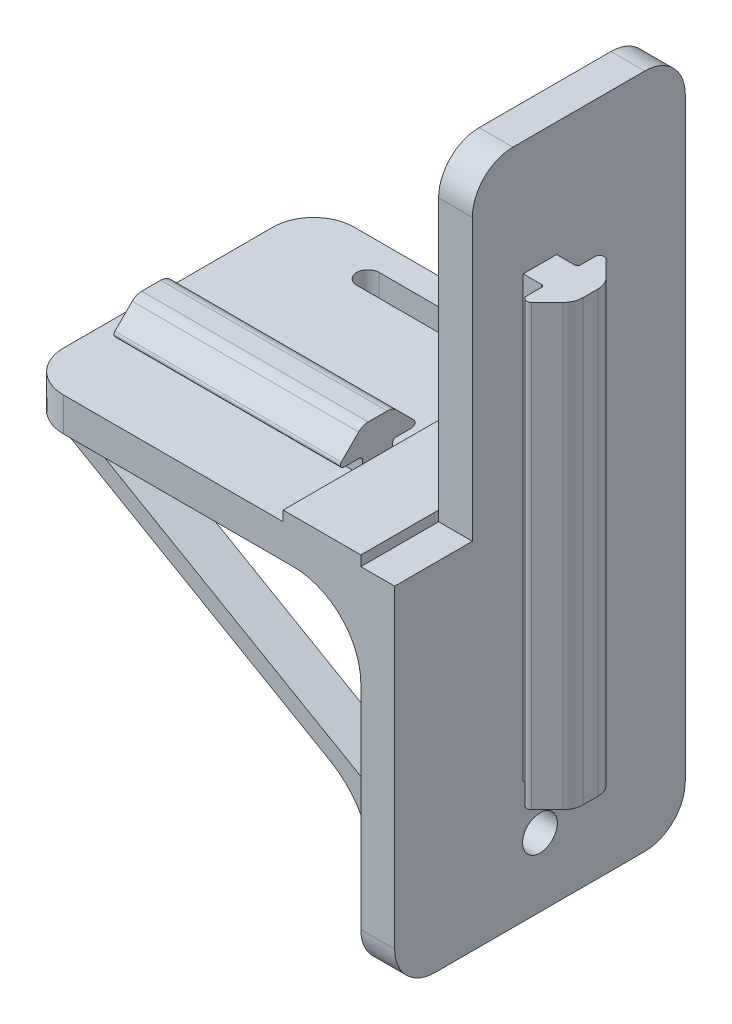
from build123d import *

# Parameters (mm, degrees)
BOSS_EXTRUDE5_DEPTH  = 50
SKETCH11_W           = 43
SKETCH11_H           = 100
BOSS_EXTRUDE6_DEPTH  = 5
BOSS_EXTRUDE8_DEPTH  = 55
SKETCH13_W           = 11.5
SKETCH13_H           = 47.5
CUT_EXTRUDE1_DEPTH   = 55
BOSS_EXTRUDE9_DEPTH  = 6
FILLET7_R            = 12
FILLET7_OF_MIRROR1_R = 12
FILLET8_R            = 6
BOSS_EXTRUDE10_START = 8
BOSS_EXTRUDE10_DEPTH = 8
FILLET12_R           = 10
BOSS_EXTRUDE11_DEPTH = 57
SKETCH16_R           = 2.575
CUT_EXTRUDE2_DEPTH   = 10
SKETCH17_W           = 27.480150942
SKETCH17_H           = 1.5
BOSS_EXTRUDE12_DEPTH = 11.5
BOSS_EXTRUDE15_START = -5
BOSS_EXTRUDE15_DEPTH = 33.5
CUT_EXTRUDE3_DEPTH   = 6


with BuildPart() as part:
    # Sketch9 → Boss-Extrude5 (new body)
    with BuildSketch(Plane(origin=(0, 245, 0), x_dir=(1, 0, 0), z_dir=(0, 1, 0))):
        with BuildLine():
            Line((389.629800237, -111.599739584), (387.629800237, -111.599739584))
            Line((387.629800237, -111.599739584), (387.629800237, -106.649739584))
            Line((387.629800237, -106.649739584), (389.629800237, -106.649739584))
            Line((389.629800237, -106.649739584), (390.329799474, -106.649739584))
            ThreePointArc((390.329799474, -106.649739584), (390.605571069, -106.535511279), (390.719799474, -106.259739725))
            Line((390.719799474, -106.259739725), (390.719800256, -104.090618139))
            ThreePointArc((390.719800256, -104.090618139), (391.145748802, -103.453141463), (391.897703935, -103.602714709))
            Line((391.897703935, -103.602714709), (394.237480965, -105.942491739))
            ThreePointArc((394.237480965, -105.942491739), (394.868289671, -106.886563682), (395.089800232, -108.000172467))
            Line((395.089800232, -108.000172467), (395.089800237, -110.249306685))
            ThreePointArc((395.089800237, -110.249306685), (394.868289678, -111.362915477), (394.23748097, -112.306987424))
            Line((394.23748097, -112.306987424), (391.897703941, -114.646764454))
            ThreePointArc((391.897703941, -114.646764454), (391.145748809, -114.7963377), (390.719800262, -114.158861025))
            Line((390.719800262, -114.158861025), (390.719799474, -111.989739443))
            ThreePointArc((390.719799474, -111.989739443), (390.605571069, -111.71396789), (390.329799474, -111.599739584))
            Line((390.329799474, -111.599739584), (389.629800237, -111.599739584))
        make_face()
    extrude(amount=-BOSS_EXTRUDE5_DEPTH)

    # Sketch11 → Boss-Extrude6 (add)
    with BuildSketch(Plane.ZY.offset(-387.629800242)):
        with Locations((109.124739584, 220)):
            Rectangle(SKETCH11_W, SKETCH11_H)
    extrude(amount=BOSS_EXTRUDE6_DEPTH)

    # Sketch12 → Boss-Extrude8 (add)
    with BuildSketch(Plane.ZY.offset(-387.629800242)):
        Polygon((130.624739584, 222.5), (89.124739584, 222.5), (87.624739584, 222.5), (87.624739584, 217.5), (89.124739584, 217.5), (130.624739584, 217.5), align=None)
    extrude(amount=BOSS_EXTRUDE8_DEPTH)

    # Sketch13 → Cut-Extrude1 (cut)
    with BuildSketch(Plane.ZY.offset(-387.629800242)):
        with Locations((124.874739584, 246.25)):
            Rectangle(SKETCH13_W, SKETCH13_H)
    extrude(amount=CUT_EXTRUDE1_DEPTH, mode=Mode.SUBTRACT)

    # Sketch15 → Boss-Extrude9 (add)
    with BuildSketch(Plane.XY.offset(129.124739584)):
        Polygon((335.629800242, 217.5), (382.629800242, 190.364537348), (382.629800242, 193.251288694), (340.629800242, 217.5), align=None)
    boss_extrude9 = extrude(amount=-BOSS_EXTRUDE9_DEPTH)

    # Fillet7
    # the kernel refuses this fillet: 12 mm, written as the material it adds along each edge
    with BuildSketch(Plane(origin=(335.629800242, 217.5, 129.124739584), x_dir=(-1, 0, 0), z_dir=(0, 0, -1))) as fillet7_piece_1:
        with BuildLine():
            CenterArc((3.218847051, -11.998004249), FILLET7_R, 91.044975628, 28.955024372)
            Line((-2.781152949, -1.605699404), (-2.901152949, -1.397853307))
            Line((-2.901152949, -1.397853307), (-0.12, 0.207846097))
            Line((-0.12, 0.207846097), (0, 0.24))
            ThreePointArc((0, 0.24), (1.5, 0.24), (2.995623059, 0.239960085))
            Line((2.995623059, 0.239960085), (3, 0))
        make_face()
    extrude(amount=6)
    with BuildSketch(Plane(origin=(382.629800242, 190.364537348, 129.124739584), x_dir=(0, -1, 0), z_dir=(0, 0, -1))) as fillet7_piece_2:
        with BuildLine():
            CenterArc((FILLET7_R * 0.57735026919, FILLET7_R), FILLET7_R, 210, 60)
            Line((-FILLET7_R * 0.288675134595, FILLET7_R * 0.5), (-FILLET7_R * 0.305995642671, FILLET7_R * 0.49))
            Line((-FILLET7_R * 0.305995642671, FILLET7_R * 0.49), (-FILLET7_R * 0.0115470053838, -FILLET7_R * 0.02))
            Line((-FILLET7_R * 0.0115470053838, -FILLET7_R * 0.02), (FILLET7_R * 0.57735026919, -FILLET7_R * 0.02))
            Line((FILLET7_R * 0.57735026919, -FILLET7_R * 0.02), (FILLET7_R * 0.57735026919, 0))
        make_face()
    extrude(amount=6)

    # Mirror1: Boss-Extrude9 across plane
    add(boss_extrude9.mirror(Plane.XY.offset(110.624739584)))

    # Fillet7 of Mirror1
    # the kernel refuses this fillet: 12 mm, written as the material it adds along each edge
    with BuildSketch(Plane(origin=(335.629800242, 217.5, 92.124739584), x_dir=(-1, 0, 0), z_dir=(0, 0, 1))) as fillet7_of_mirror1_piece_1:
        with BuildLine():
            CenterArc((3.218847051, 11.998004249), FILLET7_OF_MIRROR1_R, 240, 28.955024372)
            Line((-2.781152949, 1.605699404), (-2.901152949, 1.397853307))
            Line((-2.901152949, 1.397853307), (-0.12, -0.207846097))
            Line((-0.12, -0.207846097), (0, -0.24))
            ThreePointArc((0, -0.24), (1.5, -0.24), (2.995623059, -0.239960085))
            Line((2.995623059, -0.239960085), (3, 0))
        make_face()
    extrude(amount=6)
    with BuildSketch(Plane(origin=(382.629800242, 190.364537348, 92.124739584), x_dir=(0, -1, 0), z_dir=(0, 0, 1))) as fillet7_of_mirror1_piece_2:
        with BuildLine():
            CenterArc((FILLET7_OF_MIRROR1_R * 0.57735026919, -FILLET7_OF_MIRROR1_R), FILLET7_OF_MIRROR1_R, 90, 60)
            Line((-FILLET7_OF_MIRROR1_R * 0.288675134595, -FILLET7_OF_MIRROR1_R * 0.5), (-FILLET7_OF_MIRROR1_R * 0.305995642671, -FILLET7_OF_MIRROR1_R * 0.49))
            Line((-FILLET7_OF_MIRROR1_R * 0.305995642671, -FILLET7_OF_MIRROR1_R * 0.49), (-FILLET7_OF_MIRROR1_R * 0.0115470053838, FILLET7_OF_MIRROR1_R * 0.02))
            Line((-FILLET7_OF_MIRROR1_R * 0.0115470053838, FILLET7_OF_MIRROR1_R * 0.02), (FILLET7_OF_MIRROR1_R * 0.57735026919, FILLET7_OF_MIRROR1_R * 0.02))
            Line((FILLET7_OF_MIRROR1_R * 0.57735026919, FILLET7_OF_MIRROR1_R * 0.02), (FILLET7_OF_MIRROR1_R * 0.57735026919, 0))
        make_face()
    extrude(amount=6)

    # Fillet8
    # the kernel refuses this fillet: 6 mm, written as the material it takes off along each edge
    with BuildSketch(Plane(origin=(402.629800242, 270, 87.624739584), x_dir=(0, 0, 1), z_dir=(-1, 0, 0)), Plane(origin=(332.629800242, 237.5, 87.624739584), x_dir=(0, 0, 1), z_dir=(0, -1, 0)), Plane(origin=(402.629800242, 270, 119.124739584), x_dir=(0, -1, 0), z_dir=(-1, 0, 0))) as fillet8_piece_1:
        with BuildLine():
            CenterArc((FILLET8_R, -FILLET8_R), FILLET8_R, 90, 90)
            Line((0, -FILLET8_R), (0, 0))
            Line((0, 0), (FILLET8_R, 0))
        make_face()
    extrude(amount=35, mode=Mode.SUBTRACT)
    with BuildSketch(Plane(origin=(402.629800242, 170, 87.624739584), x_dir=(0, 0, 1), z_dir=(-1, 0, 0)), Plane(origin=(402.629800242, 170, 130.624739584), x_dir=(0, 1, 0), z_dir=(-1, 0, 0)), Plane(origin=(332.629800242, 202.5, 130.624739584), x_dir=(1, 0, 0), z_dir=(0, 1, 0))) as fillet8_piece_2:
        with BuildLine():
            CenterArc((FILLET8_R, FILLET8_R), FILLET8_R, 180, 90)
            Line((0, FILLET8_R), (0, 0))
            Line((0, 0), (FILLET8_R, 0))
        make_face()
    extrude(amount=35, mode=Mode.SUBTRACT)

    # Sketch9<2> → Boss-Extrude10 (add)
    with BuildSketch(Plane(origin=(0, 245, 0), x_dir=(1, 0, 0), z_dir=(0, 1, 0)).offset(BOSS_EXTRUDE10_START)):
        with BuildLine():
            Line((389.629800237, -111.599739584), (387.629800237, -111.599739584))
            Line((387.629800237, -111.599739584), (387.629800237, -106.649739584))
            Line((387.629800237, -106.649739584), (389.629800237, -106.649739584))
            Line((389.629800237, -106.649739584), (390.329799474, -106.649739584))
            ThreePointArc((390.329799474, -106.649739584), (390.605571069, -106.535511279), (390.719799474, -106.259739725))
            Line((390.719799474, -106.259739725), (390.719800256, -104.090618139))
            ThreePointArc((390.719800256, -104.090618139), (391.145748802, -103.453141463), (391.897703935, -103.602714709))
            Line((391.897703935, -103.602714709), (394.237480965, -105.942491739))
            ThreePointArc((394.237480965, -105.942491739), (394.868289671, -106.886563682), (395.089800232, -108.000172467))
            Line((395.089800232, -108.000172467), (395.089800237, -110.249306685))
            ThreePointArc((395.089800237, -110.249306685), (394.868289678, -111.362915477), (394.23748097, -112.306987424))
            Line((394.23748097, -112.306987424), (391.897703941, -114.646764454))
            ThreePointArc((391.897703941, -114.646764454), (391.145748809, -114.7963377), (390.719800262, -114.158861025))
            Line((390.719800262, -114.158861025), (390.719799474, -111.989739443))
            ThreePointArc((390.719799474, -111.989739443), (390.605571069, -111.71396789), (390.329799474, -111.599739584))
            Line((390.329799474, -111.599739584), (389.629800237, -111.599739584))
        make_face()
    extrude(amount=-BOSS_EXTRUDE10_DEPTH)

    # Fillet12
    fillet12_edges = [part.edges().sort_by_distance(p)[0] for p in [
        (382.629800242, 217.5, 109.124739584),
    ]]
    fillet(fillet12_edges, radius=FILLET12_R)

    # Sketch9<3> → Boss-Extrude11 (add)
    with BuildSketch(Plane(origin=(0, 245, 0), x_dir=(1, 0, 0), z_dir=(0, 1, 0))):
        with BuildLine():
            Line((389.629800237, -111.599739584), (387.629800237, -111.599739584))
            Line((387.629800237, -111.599739584), (387.629800237, -106.649739584))
            Line((387.629800237, -106.649739584), (389.629800237, -106.649739584))
            Line((389.629800237, -106.649739584), (390.329799474, -106.649739584))
            ThreePointArc((390.329799474, -106.649739584), (390.605571069, -106.535511279), (390.719799474, -106.259739725))
            Line((390.719799474, -106.259739725), (390.719800256, -104.090618139))
            ThreePointArc((390.719800256, -104.090618139), (391.145748802, -103.453141463), (391.897703935, -103.602714709))
            Line((391.897703935, -103.602714709), (394.237480965, -105.942491739))
            ThreePointArc((394.237480965, -105.942491739), (394.868289671, -106.886563682), (395.089800232, -108.000172467))
            Line((395.089800232, -108.000172467), (395.089800237, -110.249306685))
            ThreePointArc((395.089800237, -110.249306685), (394.868289678, -111.362915477), (394.23748097, -112.306987424))
            Line((394.23748097, -112.306987424), (391.897703941, -114.646764454))
            ThreePointArc((391.897703941, -114.646764454), (391.145748809, -114.7963377), (390.719800262, -114.158861025))
            Line((390.719800262, -114.158861025), (390.719799474, -111.989739443))
            ThreePointArc((390.719799474, -111.989739443), (390.605571069, -111.71396789), (390.329799474, -111.599739584))
            Line((390.329799474, -111.599739584), (389.629800237, -111.599739584))
        make_face()
    extrude(amount=-BOSS_EXTRUDE11_DEPTH)

    # Sketch16 → Cut-Extrude2 (cut)
    with BuildSketch(Plane.ZY.offset(-382.629800242)):
        with Locations((109.124739584, 180.133064736)):
            Circle(SKETCH16_R)
    extrude(amount=-CUT_EXTRUDE2_DEPTH, mode=Mode.SUBTRACT)

    # Sketch17 → Boss-Extrude12 (add)
    with BuildSketch(Plane(origin=(371.129800242, 0, 0), x_dir=(0, 0, -1), z_dir=(1, 0, 0))):
        with Locations((-116.884664113, 223.25)):
            Rectangle(SKETCH17_W, SKETCH17_H)
    extrude(amount=BOSS_EXTRUDE12_DEPTH)

    # Sketch22 → Boss-Extrude15 (add)
    with BuildSketch(Plane.ZY.offset(-332.629800242).offset(BOSS_EXTRUDE15_START)):
        with BuildLine():
            Line((114.406150208, 222.5), (114.406150208, 224.5))
            ThreePointArc((114.406150208, 224.5), (114.259703598, 224.853553391), (113.906150208, 225))
            Line((113.906150208, 225), (111.613256989, 225))
            ThreePointArc((111.613256989, 225), (111.151317223, 225.308658284), (111.259703598, 225.853553391))
            Line((111.259703598, 225.853553391), (113.82036377, 228.414213562))
            ThreePointArc((113.82036377, 228.414213562), (114.469210468, 228.847759065), (115.234577333, 229))
            Line((115.234577333, 229), (116.634664113, 229))
            Line((116.634664113, 229), (118.034750894, 229))
            ThreePointArc((118.034750894, 229), (118.800117758, 228.847759065), (119.448964456, 228.414213562))
            Line((119.448964456, 228.414213562), (122.009624628, 225.853553391))
            ThreePointArc((122.009624628, 225.853553391), (122.118011003, 225.308658284), (121.656071237, 225))
            Line((121.656071237, 225), (119.363178018, 225))
            ThreePointArc((119.363178018, 225), (119.009624628, 224.853553391), (118.863178018, 224.5))
            Line((118.863178018, 224.5), (118.863178018, 222.5))
            Line((118.863178018, 222.5), (114.406150208, 222.5))
        make_face()
    extrude(amount=-BOSS_EXTRUDE15_DEPTH)

    # Sketch23 → Cut-Extrude3 (cut)
    with BuildSketch(Plane(origin=(0, 222.5, 0), x_dir=(1, 0, 0), z_dir=(0, 1, 0))):
        with BuildLine():
            Line((346.279800242, -91.576720164), (374.979800242, -91.576720164))
            ThreePointArc((374.979800242, -91.576720164), (376.629800242, -93.226720164), (374.979800242, -94.876720164))
            Line((374.979800242, -94.876720164), (346.279800242, -94.876720164))
            ThreePointArc((346.279800242, -94.876720164), (344.629800242, -93.226720164), (346.279800242, -91.576720164))
        make_face()
    extrude(amount=-CUT_EXTRUDE3_DEPTH, mode=Mode.SUBTRACT)


solid = part.part
